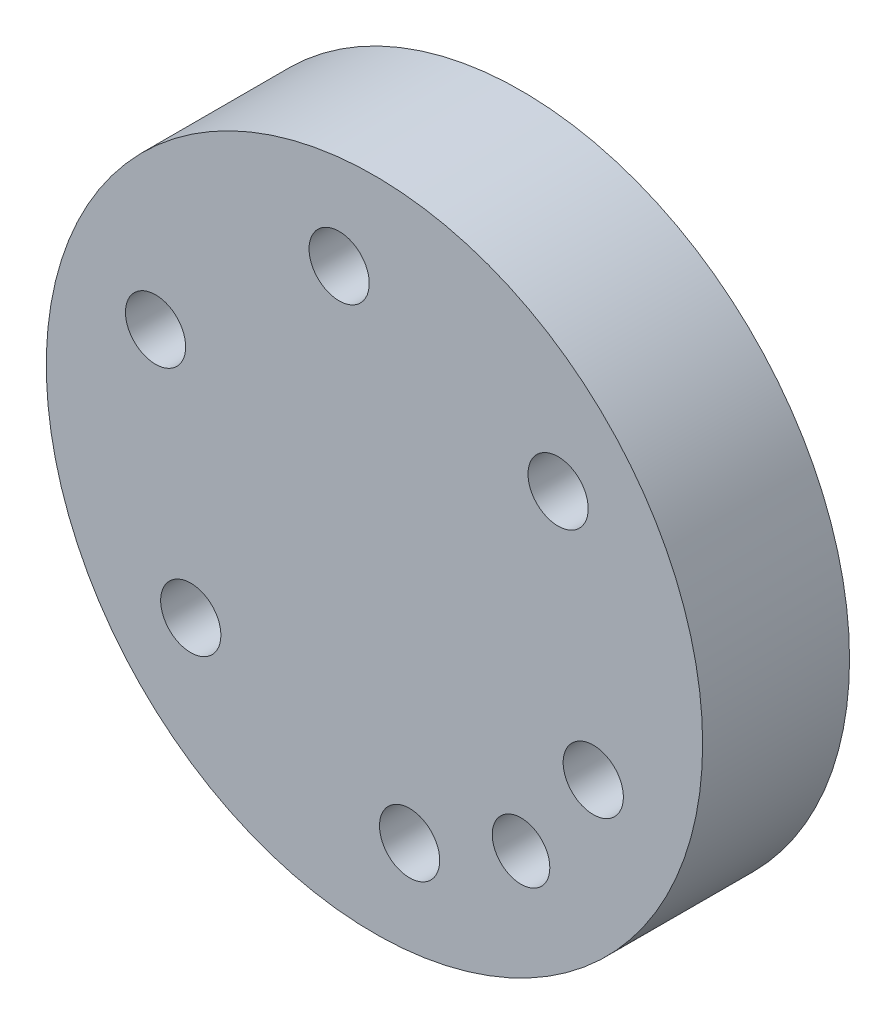
from build123d import *

# Parameters (mm, degrees)
SKETCH2_R           = 88.7
BOSS_EXTRUDE1_DEPTH = 24.7
BOSS_EXTRUDE2_START = 15
SKETCH3_R           = 88.7
SKETCH3_R_2         = 8.1375
BOSS_EXTRUDE2_DEPTH = 15
FILLET1_R           = 2
FILLET2_R           = 3
FILLET3_R           = 2


with BuildPart() as part:
    # Sketch2 → Boss-Extrude1 (new body)
    with BuildSketch(Plane.XY):
        with Locations((22.380830856, 278.150413141)):
            Circle(SKETCH2_R)
        with BuildLine():
            ThreePointArc((22.380830856, 354.550413141), (-54.019169144, 278.150413141), (22.380830856, 201.750413141))
            ThreePointArc((22.380830856, 201.750413141), (98.780830856, 278.150413141), (22.380830856, 354.550413141))
        make_face(mode=Mode.SUBTRACT)
    extrude(amount=-BOSS_EXTRUDE1_DEPTH)

    # Sketch3 → Boss-Extrude2 (add)
    with BuildSketch(Plane.XY.offset(BOSS_EXTRUDE2_START)):
        with Locations((22.380830856, 278.150413141)):
            Circle(SKETCH3_R)
        with Locations((12.834949907, 340.867975839)):
            Circle(SKETCH3_R_2, mode=Mode.SUBTRACT)
        with Locations((72.010243633, 317.73432135)):
            Circle(SKETCH3_R_2, mode=Mode.SUBTRACT)
        with Locations((-36.784620153, 301.21805109)):
            Circle(SKETCH3_R_2, mode=Mode.SUBTRACT)
        with Locations((-27.264784017, 238.487003795)):
            Circle(SKETCH3_R_2, mode=Mode.SUBTRACT)
        with Locations((31.880563493, 215.334967411)):
            Circle(SKETCH3_R_2, mode=Mode.SUBTRACT)
        with Locations((81.519347087, 254.971228106)):
            Circle(SKETCH3_R_2, mode=Mode.SUBTRACT)
        with BuildLine():
            ThreePointArc((61.996469473, 236.312741601), (54.216779809, 228.533051937), (61.996469473, 220.753362274))
            ThreePointArc((61.996469473, 220.753362274), (69.776159136, 228.533051937), (61.996469473, 236.312741601))
        make_face(mode=Mode.SUBTRACT)
    extrude(amount=-BOSS_EXTRUDE2_DEPTH)

    # Fillet1
    fillet1_edges = [part.edges().sort_by_distance(p)[0] for p in [
        (61.996469473, 220.753362274, 0),
    ]]
    fillet(fillet1_edges, radius=FILLET1_R)

    # Chamfer1: read off the stored shape, not the designer's step
    # Chamfer1 outline → Chamfer1 (revolve, cut)
    with BuildSketch(Plane(origin=(22.380830856, 278.150413141, 0), x_dir=(1, 0, 0), z_dir=(0, -1, 0))):
        Polygon((80.9, -24.7), (76.4, -16.7), (76.4, -24.7), align=None)
    revolve(axis=Axis((22.380830856, 278.150413141, 0), (0, 0, 1)), mode=Mode.SUBTRACT)

    # Fillet2
    fillet2_edges = [part.edges().sort_by_distance(p)[0] for p in [
        (76.403788939, 332.173371224, -16.7),
    ]]
    fillet(fillet2_edges, radius=FILLET2_R)

    # Fillet3
    fillet3_edges = [part.edges().sort_by_distance(p)[0] for p in [
        (-58.519169144, 278.150413141, -24.7),
    ]]
    fillet(fillet3_edges, radius=FILLET3_R)


solid = part.part
